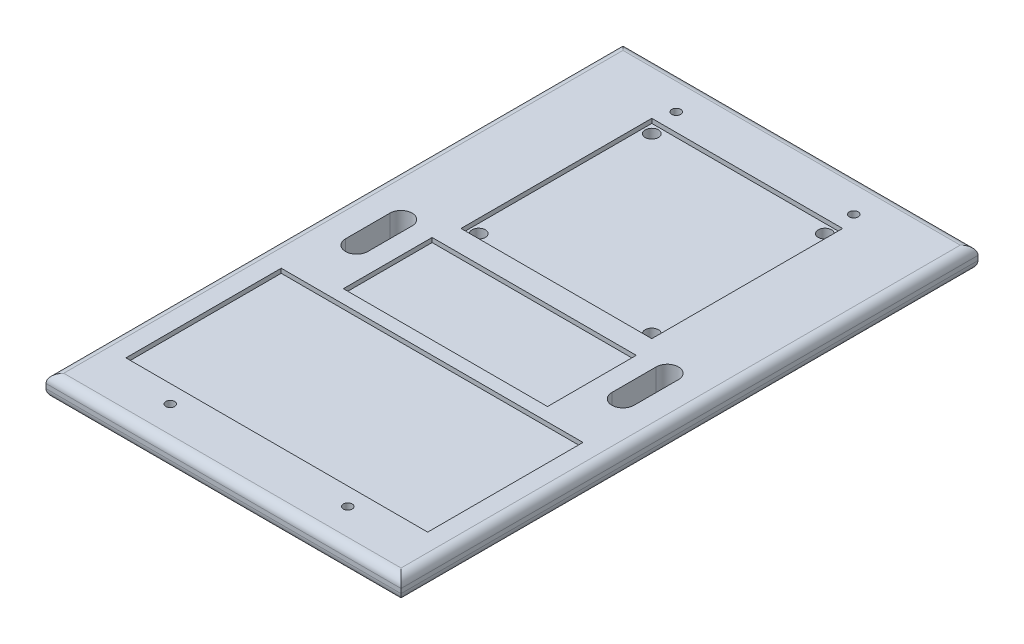
from build123d import *

# Parameters (mm, degrees)
SKETCH2_W               = 80
SKETCH2_H               = 130
BOSS_EXTRUDE1_DEPTH     = 3
SKETCH3_W               = 80
SKETCH3_H               = 130
BOSS_EXTRUDE2_DEPTH     = 2
FILLET1_R               = 2
CUT_EXTRUDE1_DEPTH      = 153.672852859
CUT_EXTRUDE1_DEPTH_BACK = 153.672852859
SKETCH6_R               = 1
CUT_EXTRUDE2_DEPTH      = 3
SKETCH6_3_W             = 68
SKETCH6_3_H             = 35
SKETCH6_3_W_2           = 43
SKETCH6_3_H_2           = 43
SKETCH6_3_R             = 1.5
SKETCH6_3_W_3           = 46
SKETCH6_3_H_3           = 20
CUT_EXTRUDE3_DEPTH      = 1
SKETCH6_4_R             = 1.5
AGUJEROSL298N_DEPTH     = 153.725243493


with BuildPart() as part:
    # Sketch2 → Boss-Extrude1 (new body)
    with BuildSketch(Plane(origin=(0, 0, 0), x_dir=(1, 0, 0), z_dir=(0, 1, 0))):
        with Locations((-40, 65)):
            Rectangle(SKETCH2_W, SKETCH2_H)
        with BuildLine():
            Line((-4, 28), (-4, 8))
            ThreePointArc((-4, 8), (-8, 4), (-12, 8))
            Line((-12, 8), (-12, 28))
            ThreePointArc((-12, 28), (-8, 32), (-4, 28))
        make_face(mode=Mode.SUBTRACT)
        with BuildLine():
            Line((-4, 102), (-4, 122))
            ThreePointArc((-4, 122), (-8, 126), (-12, 122))
            Line((-12, 122), (-12, 102))
            ThreePointArc((-12, 102), (-8, 98), (-4, 102))
        make_face(mode=Mode.SUBTRACT)
        with BuildLine():
            Line((-76, 102), (-76, 122))
            ThreePointArc((-76, 122), (-72, 126), (-68, 122))
            Line((-68, 122), (-68, 102))
            ThreePointArc((-68, 102), (-72, 98), (-76, 102))
        make_face(mode=Mode.SUBTRACT)
        with BuildLine():
            Line((-76, 28), (-76, 8))
            ThreePointArc((-76, 8), (-72, 4), (-68, 8))
            Line((-68, 8), (-68, 28))
            ThreePointArc((-68, 28), (-72, 32), (-76, 28))
        make_face(mode=Mode.SUBTRACT)
    extrude(amount=-BOSS_EXTRUDE1_DEPTH)

    # Sketch3 → Boss-Extrude2 (add)
    with BuildSketch(Plane(origin=(0, 0, 0), x_dir=(1, 0, 0), z_dir=(0, 1, 0))):
        with Locations((-40, 65)):
            Rectangle(SKETCH3_W, SKETCH3_H)
    extrude(amount=BOSS_EXTRUDE2_DEPTH)

    # Fillet1
    fillet1_edges = [part.edges().sort_by_distance(p)[0] for p in [
        (-40, -3, -130),
        (-40, 2, -130),
        (-80, -3, -65),
        (-80, 2, -65),
        (0, 2, -65),
        (0, -3, -65),
        (-40, -3, 0),
        (-40, 2, 0),
    ]]
    fillet(fillet1_edges, radius=FILLET1_R)

    # Sketch4 → Cut-Extrude1 (cut, two sides: drawn at the far end of the back side and taken through both)
    with BuildSketch(Plane(origin=(0, 0, 0), x_dir=(1, 0, 0), z_dir=(0, 1, 0)).offset(-CUT_EXTRUDE1_DEPTH_BACK)):
        with BuildLine():
            Line((-7.5, 70), (-7.5, 60))
            ThreePointArc((-7.5, 60), (-10, 57.5), (-12.5, 60))
            Line((-12.5, 60), (-12.5, 70))
            ThreePointArc((-12.5, 70), (-10, 72.5), (-7.5, 70))
        make_face()
        with BuildLine():
            Line((-72.5, 70), (-72.5, 60))
            ThreePointArc((-72.5, 60), (-70, 57.5), (-67.5, 60))
            Line((-67.5, 60), (-67.5, 70))
            ThreePointArc((-67.5, 70), (-70, 72.5), (-72.5, 70))
        make_face()
    extrude(amount=CUT_EXTRUDE1_DEPTH + CUT_EXTRUDE1_DEPTH_BACK, mode=Mode.SUBTRACT)

    # Sketch6 → Cut-Extrude2 (cut)
    with BuildSketch(Plane(origin=(0, 2, 0), x_dir=(1, 0, 0), z_dir=(0, 1, 0))):
        with Locations((-60, 122)):
            Circle(SKETCH6_R)
        with Locations((-20, 122)):
            Circle(SKETCH6_R)
        with Locations((-20, 8)):
            Circle(SKETCH6_R)
        with Locations((-60, 8)):
            Circle(SKETCH6_R)
    extrude(amount=-CUT_EXTRUDE2_DEPTH, mode=Mode.SUBTRACT)

    # Sketch6<3> → Cut-Extrude3 (cut)
    # profile 1 of 3: a face of its own
    with BuildSketch(Plane(origin=(0, 2, 0), x_dir=(1, 0, 0), z_dir=(0, 1, 0))):
        with Locations((-40, 29.5)):
            Rectangle(SKETCH6_3_W, SKETCH6_3_H)
    # profile 2 of 3: a face of its own
    with BuildSketch(Plane(origin=(0, 2, 0), x_dir=(1, 0, 0), z_dir=(0, 1, 0))):
        with Locations((-40, 96.5)):
            Rectangle(SKETCH6_3_W_2, SKETCH6_3_H_2)
        with Locations((-59.5, 77)):
            Circle(SKETCH6_3_R, mode=Mode.SUBTRACT)
        with Locations((-59.5, 116)):
            Circle(SKETCH6_3_R, mode=Mode.SUBTRACT)
        with Locations((-20.5, 77)):
            Circle(SKETCH6_3_R, mode=Mode.SUBTRACT)
        with Locations((-20.5, 116)):
            Circle(SKETCH6_3_R, mode=Mode.SUBTRACT)
    # profile 3 of 3: a face of its own
    with BuildSketch(Plane(origin=(0, 2, 0), x_dir=(1, 0, 0), z_dir=(0, 1, 0))):
        with Locations((-40, 60)):
            Rectangle(SKETCH6_3_W_3, SKETCH6_3_H_3)
    extrude(amount=-CUT_EXTRUDE3_DEPTH, mode=Mode.SUBTRACT)

    # Sketch6<4> → AgujerosL298N (cut, through all)
    with BuildSketch(Plane(origin=(0, 2, 0), x_dir=(1, 0, 0), z_dir=(0, 1, 0))):
        with Locations((-20.5, 116)):
            Circle(SKETCH6_4_R)
        with Locations((-20.5, 77)):
            Circle(SKETCH6_4_R)
        with Locations((-59.5, 77)):
            Circle(SKETCH6_4_R)
        with Locations((-59.5, 116)):
            Circle(SKETCH6_4_R)
    extrude(amount=-AGUJEROSL298N_DEPTH, mode=Mode.SUBTRACT)


solid = part.part
